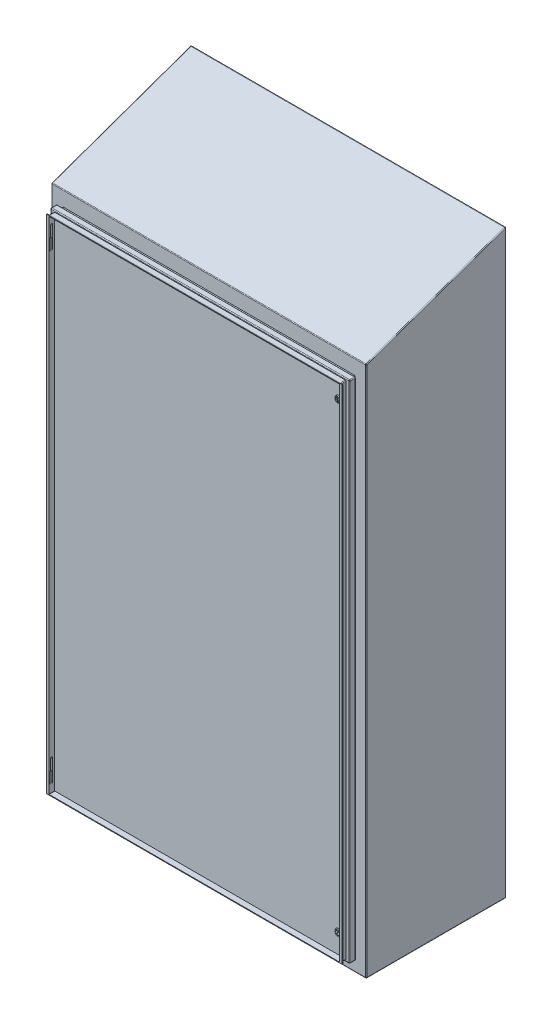
from build123d import *
from build123d.topology import SkipClean

# Parameters (mm, degrees)
SKETCH3_W            = 914.4
SKETCH3_H            = 1544.828
EXTRUDE1_DEPTH       = 406.4
SKETCH4_W            = 848.34476
SKETCH4_H            = 1457.94476
EXTRUDE2_DEPTH       = 20.32
SKETCH9_W            = 848.34476
SKETCH9_H            = 1457.94476
EXTRUDE6_DEPTH       = 21.844
EXTRUDE14_DEPTH      = 914.4
FILLET1_R            = 2.371725
SHELL1_T             = -1.89738
SKETCH5_R            = 6.35
CUT_EXTRUDE1_DEPTH   = 1117.712859019
SKETCH23_W           = 859.155
SKETCH23_H           = 1458.0616
EXTRUDE15_DEPTH      = 2.032
SKETCH6_W            = 838.2
SKETCH6_H            = 1447.8
SKETCH6_R            = 2.38125
EXTRUDE3_DEPTH       = 3.175
SKETCH10_R           = 3.57505
SKETCH10_R_2         = 2.38125
EXTRUDE7_DEPTH       = 25.15362
SKETCH7_W            = 868.68
SKETCH7_H            = 1467.5866
EXTRUDE4_DEPTH       = 17.018
FILLET2_R            = 2.371725
SHELL2_T             = -1.89738
FILLET3_R            = 0.762
SKETCH11_R           = 2.38125
EXTRUDE8_DEPTH       = 31.75
EXTRUDE16_DEPTH      = 0.508
EXTRUDE16_DEPTH_BACK = 25.4
SKETCH25_R           = 2.38125
SKETCH26_R           = 4.7625
EXTRUDE17_DEPTH      = 31.242
CHAMFER3_SIZE        = 0.508
EXTRUDE18_DEPTH      = 31.242
SKETCH16_R           = 10.16
EXTRUDE11_DEPTH      = 0.508
SKETCH17_R           = 10.16
EXTRUDE12_DEPTH      = 2.54
EXTRUDE12_TAPER      = 30
SKETCH18_R           = 6.35
CUT_EXTRUDE4_DEPTH   = 2.032
CHAMFER2_SIZE        = 0.508
SKETCH19_R           = 6.35
EXTRUDE13_DEPTH      = 2.032
FILLET9_R            = 0.762
CUT_EXTRUDE5_DEPTH   = 2.032
LPATTERN3_COUNT      = 2
LPATTERN3_PITCH      = 670.814
LPATTERN3_2_COUNT    = 2
LPATTERN3_2_PITCH    = 670.814
LPATTERN2_COUNT      = 2
LPATTERN2_PITCH      = 670.814


with BuildPart() as part:
    # Sketch3 → Extrude1 (new body)
    with BuildSketch(Plane.XY):
        Rectangle(SKETCH3_W, SKETCH3_H)
    extrude(amount=EXTRUDE1_DEPTH)

    # Sketch4 → Extrude2 (add)
    with BuildSketch(Plane.XY.offset(406.4)):
        Rectangle(SKETCH4_W, SKETCH4_H)
    extrude(amount=EXTRUDE2_DEPTH)

    # Sketch9 → Extrude6 (add)
    with BuildSketch(Plane.XY.offset(426.72)):
        Rectangle(SKETCH9_W, SKETCH9_H)
    extrude(amount=EXTRUDE6_DEPTH)

    # Sketch22 → Extrude14 (add)
    with BuildSketch(Plane(origin=(457.2, 0, 0), x_dir=(0, 0, -1), z_dir=(1, 0, 0))):
        Polygon((-406.4, 772.414), (0, 772.414), (0, 916.686), align=None)
    extrude(amount=-EXTRUDE14_DEPTH)

    # Fillet1
    fillet1_edges = [part.edges().sort_by_distance(p)[0] for p in [
        (457.2, 0, 406.4),
        (0, 772.414, 406.4),
        (424.17238, 728.97238, 427.482),
        (-424.17238, 728.97238, 427.482),
        (-424.17238, -728.97238, 427.482),
        (424.17238, -728.97238, 427.482),
        (-457.2, 844.55, 203.2),
        (0, 916.686, 0),
        (457.2, 844.55, 203.2),
        (-457.2, 0, 406.4),
        (457.2, 72.136, 0),
        (0, -772.414, 0),
        (-457.2, 72.136, 0),
        (0, -772.414, 406.4),
        (457.2, -772.414, 203.2),
        (-457.2, -772.414, 203.2),
    ]]
    fillet(fillet1_edges, radius=FILLET1_R)

    # Shell1
    shell1_openings = [part.faces().sort_by_distance(p)[0] for p in [
        (0, 0, 448.564),
    ]]
    offset(amount=SHELL1_T, openings=shell1_openings, kind=Kind.INTERSECTION)

    # Sketch5 → Cut-Extrude1 (cut, through all)
    with BuildSketch(Plane.XY.offset(1.89738)):
        with Locations((438.15, 742.95)):
            Circle(SKETCH5_R)
        with Locations((438.15, -742.95)):
            Circle(SKETCH5_R)
        with Locations((-438.15, -742.95)):
            Circle(SKETCH5_R)
        with Locations((-438.15, 742.95)):
            Circle(SKETCH5_R)
    extrude(amount=-CUT_EXTRUDE1_DEPTH, mode=Mode.SUBTRACT)

    # Sketch23 → Extrude15 (add)
    with BuildSketch(Plane.XY.offset(448.564)):
        Rectangle(SKETCH23_W, SKETCH23_H)
        with BuildLine():
            Line((421.800655, 728.97238), (-421.800655, 728.97238))
            ThreePointArc((-421.800655, 728.97238), (-423.477717831, 728.277717831), (-424.17238, 726.600655))
            Line((-424.17238, 726.600655), (-424.17238, -726.600655))
            ThreePointArc((-424.17238, -726.600655), (-423.477717831, -728.277717831), (-421.800655, -728.97238))
            Line((-421.800655, -728.97238), (421.800655, -728.97238))
            ThreePointArc((421.800655, -728.97238), (423.477717831, -728.277717831), (424.17238, -726.600655))
            Line((424.17238, -726.600655), (424.17238, 726.600655))
            ThreePointArc((424.17238, 726.600655), (423.477717831, 728.277717831), (421.800655, 728.97238))
        make_face(mode=Mode.SUBTRACT)
    extrude(amount=-EXTRUDE15_DEPTH)

    # Sketch10 → Extrude7 (add)
    # profile 1 of 4: a face of its own
    with BuildSketch(Plane.XY.offset(1.89738)):
        with Locations((-372.999, 658.749)):
            Circle(SKETCH10_R)
        with Locations((-372.999, 658.749)):
            Circle(SKETCH10_R_2, mode=Mode.SUBTRACT)
    # profile 2 of 4: a face of its own
    with BuildSketch(Plane.XY.offset(1.89738)):
        with Locations((-372.999, -658.749)):
            Circle(SKETCH10_R)
        with Locations((-372.999, -658.749)):
            Circle(SKETCH10_R_2, mode=Mode.SUBTRACT)
    # profile 3 of 4: a face of its own
    with BuildSketch(Plane.XY.offset(1.89738)):
        with Locations((372.999, -658.749)):
            Circle(SKETCH10_R)
        with Locations((372.999, -658.749)):
            Circle(SKETCH10_R_2, mode=Mode.SUBTRACT)
    # profile 4 of 4: a face of its own
    with BuildSketch(Plane.XY.offset(1.89738)):
        with Locations((372.999, 658.749)):
            Circle(SKETCH10_R)
        with Locations((372.999, 658.749)):
            Circle(SKETCH10_R_2, mode=Mode.SUBTRACT)
    extrude(amount=EXTRUDE7_DEPTH)


with BuildPart() as body_2:
    # Sketch6 → Extrude3 (new body)
    with BuildSketch(Plane.XY.offset(28.575)):
        Rectangle(SKETCH6_W, SKETCH6_H)
        with Locations((372.999, -658.749)):
            Circle(SKETCH6_R, mode=Mode.SUBTRACT)
        with Locations((372.999, 658.749)):
            Circle(SKETCH6_R, mode=Mode.SUBTRACT)
        with Locations((-372.999, 658.749)):
            Circle(SKETCH6_R, mode=Mode.SUBTRACT)
        with Locations((-372.999, -658.749)):
            Circle(SKETCH6_R, mode=Mode.SUBTRACT)
    extrude(amount=-EXTRUDE3_DEPTH)


with BuildPart() as body_3:
    # Sketch7 → Extrude4 (new body)
    with BuildSketch(Plane.XY.offset(431.8)):
        Rectangle(SKETCH7_W, SKETCH7_H)
    extrude(amount=-EXTRUDE4_DEPTH)

    # Fillet2
    fillet2_edges = [body_3.edges().sort_by_distance(p)[0] for p in [
        (0, 733.7933, 431.8),
        (434.34, 0, 431.8),
        (0, -733.7933, 431.8),
        (-434.34, 0, 431.8),
        (-434.34, 733.7933, 423.291),
        (434.34, 733.7933, 423.291),
        (434.34, -733.7933, 423.291),
        (-434.34, -733.7933, 423.291),
    ]]
    fillet(fillet2_edges, radius=FILLET2_R)

    # Shell2
    shell2_openings = [body_3.faces().sort_by_distance(p)[0] for p in [
        (0, 0, 414.782),
    ]]
    offset(amount=SHELL2_T, openings=shell2_openings, kind=Kind.INTERSECTION)

    # Fillet3
    fillet3_edges = [body_3.edges().sort_by_distance(p)[0] for p in [
        (0, 733.7933, 414.782),
        (434.34, 0, 414.782),
        (0, -733.7933, 414.782),
        (-434.34, 0, 414.782),
        (-433.645337831, -733.098637831, 414.782),
        (433.645337831, -733.098637831, 414.782),
        (433.645337831, 733.098637831, 414.782),
        (-433.645337831, 733.098637831, 414.782),
    ]]
    fillet(fillet3_edges, radius=FILLET3_R)


with BuildPart() as body_4:
    # Sketch11 → Extrude8 (new body)
    with BuildSketch(Plane(origin=(0, 0, 0), x_dir=(1, 0, 0), z_dir=(0, 1, 0))):
        with BuildLine():
            Line((-421.64762, -441.0075), (-421.64762, -446.532))
            Line((-421.64762, -446.532), (-424.18762, -446.532))
            Line((-424.18762, -446.532), (-424.18762, -445.219613484))
            ThreePointArc((-424.18762, -445.219613484), (-430.488481344, -438.548155575), (-421.64762, -441.0075))
        make_face()
        with Locations(Location((-426.41012, -441.0075, 0), (0, 0, 270))):
            Circle(SKETCH11_R, mode=Mode.SUBTRACT)
    extrude(amount=-EXTRUDE8_DEPTH)

    # Revolve1: read off the stored shape, not the designer's step
    # Revolve1 outline → Revolve1 (revolve)
    with BuildSketch(Plane(origin=(-426.41012, 0, 441.0075), x_dir=(1, 0, 0), z_dir=(0, 0, 1))):
        with BuildLine():
            Line((0, -31.75), (2.381250004, -31.75))
            Line((2.381250004, -31.75), (2.381250004, -27.625554017))
            ThreePointArc((2.381250004, -27.625554017), (1.232625705, -27.149778253), (0, -26.9875))
            Line((0, -26.9875), (0, -31.75))
        make_face()
    revolve(axis=Axis((-426.41012, 0, 441.0075), (0, 1, 0)))


with BuildPart() as body_5:
    # Sketch25 → Extrude16 (new, two sides: drawn at the far end of the back side and taken through both)
    with BuildSketch(Plane(origin=(0, 0, 0), x_dir=(1, 0, 0), z_dir=(0, 1, 0)).offset(-EXTRUDE16_DEPTH_BACK)):
        with Locations(Location((-426.41012, -441.0075, 0), (0, 0, 270))):
            Circle(SKETCH25_R)
    extrude(amount=EXTRUDE16_DEPTH + EXTRUDE16_DEPTH_BACK)

    # Sketch26 → Extrude17 (add)
    with BuildSketch(Plane(origin=(0, 0.508, 0), x_dir=(1, 0, 0), z_dir=(0, 1, 0))):
        with Locations(Location((-426.41012, -441.0075, 0), (0, 0, 90))):
            Circle(SKETCH26_R)
    extrude(amount=EXTRUDE17_DEPTH)

    # Sketch27 → Revolve2 (revolve)
    with BuildSketch(Plane(origin=(0, 31.75, 0), x_dir=(1, 0, 0), z_dir=(0, 1, 0))):
        with BuildLine():
            Line((-431.17262, -441.0075), (-421.64762, -441.0075))
            ThreePointArc((-421.64762, -441.0075), (-426.41012, -436.245), (-431.17262, -441.0075))
        make_face()
    revolve(axis=Axis((-389.465115436, 31.75, 441.0075), (-1, 0, 0)))

    # Chamfer3
    chamfer3_edges = [body_5.edges().sort_by_distance(p)[0] for p in [
        (-426.41012, -25.4, 438.62625),
    ]]
    chamfer(chamfer3_edges, length=CHAMFER3_SIZE)

    # Sketch28 → Extrude18 (add)
    with SkipClean():  # the faces are left unmerged after this step: merging them gives an invalid solid
        with BuildSketch(Plane.XZ.offset(-0.508)):
            with BuildLine():
                Line((-432.44262, 445.77), (-432.44262, 443.23))
                Line((-432.44262, 443.23), (-430.622233484, 443.23))
                ThreePointArc((-430.622233484, 443.23), (-428.869464425, 445.085861344), (-426.41012, 445.77))
                Line((-426.41012, 445.77), (-432.44262, 445.77))
            make_face()
        extrude(amount=-EXTRUDE18_DEPTH)
    add(body_5.part.scale(1), mode=Mode.REPLACE)  # the faces are merged on a copy

    # Combine1: union body 4
    add(body_4.part)


with BuildPart() as body_5_2:
    # Sketch16 → Extrude11 (new body)
    with BuildSketch(Plane.XY.offset(431.8)):
        with Locations((402.59, 0)):
            Circle(SKETCH16_R)
    extrude(amount=EXTRUDE11_DEPTH)

    # Sketch17 → Extrude12 (add)
    with BuildSketch(Plane.XY.offset(432.308)):
        with Locations((402.59, 0)):
            Circle(SKETCH17_R)
    extrude(amount=EXTRUDE12_DEPTH, taper=EXTRUDE12_TAPER)

    # Sketch18 → Cut-Extrude4 (cut)
    with BuildSketch(Plane.XY.offset(434.848)):
        with Locations((402.59, 0)):
            Circle(SKETCH18_R)
    extrude(amount=-CUT_EXTRUDE4_DEPTH, mode=Mode.SUBTRACT)

    # Chamfer2
    chamfer2_edges = [body_5_2.edges().sort_by_distance(p)[0] for p in [
        (396.24, 0, 434.848),
    ]]
    chamfer(chamfer2_edges, length=CHAMFER2_SIZE)

    # Sketch19 → Extrude13 (add)
    with BuildSketch(Plane.XY.offset(432.816)):
        with Locations((402.59, 0)):
            Circle(SKETCH19_R)
    extrude(amount=EXTRUDE13_DEPTH)

    # Fillet9
    # the kernel refuses this fillet: 0.762 mm, written as the material it takes off along each edge
    with BuildSketch(Plane(origin=(402.59, 0, 434.848), x_dir=(1, 0, 0), z_dir=(0, -1, 0))) as fillet9_piece_1:
        with BuildLine():
            CenterArc((5.63157951, -0.762), FILLET9_R, 19.471220634, 70.528779366)
            Line((5.63157951, 0), (6.35, 0))
            Line((6.35, 0), (6.35, -0.508))
        make_face()
    revolve(axis=Axis((402.59, 0, 434.848), (0, 0, 1)), mode=Mode.SUBTRACT)

    # Sketch20 → Cut-Extrude5 (cut)
    with BuildSketch(Plane.XY.offset(434.848)):
        with BuildLine():
            Line((398.379295764, 4.753153673), (404.600999711, -6.023153673))
            ThreePointArc((404.600999711, -6.023153673), (405.765, -5.499261314), (406.800704236, -4.753153673))
            Line((406.800704236, -4.753153673), (400.579000289, 6.023153673))
            ThreePointArc((400.579000289, 6.023153673), (399.415, 5.499261314), (398.379295764, 4.753153673))
        make_face()
    extrude(amount=-CUT_EXTRUDE5_DEPTH, mode=Mode.SUBTRACT)


with BuildPart() as lpattern3_1:
    # LPattern3: pattern copy
    add(body_5.part.moved(Location(Vector(0, 1, 0) * (1 * LPATTERN3_PITCH))))


with BuildPart() as lpattern3_2_1:
    # LPattern3 2: pattern copy
    add(body_5.part.moved(Location(Vector(0, -1, 0) * (1 * LPATTERN3_2_PITCH))))


with BuildPart() as lpattern3_2_2:
    # LPattern3 2: pattern copy
    add(lpattern3_1.part.moved(Location(Vector(0, -1, 0) * (1 * LPATTERN3_2_PITCH))))


with BuildPart() as lpattern2_1:
    # LPattern2: pattern copy
    add(body_5_2.part.moved(Location(Vector(0, 1, 0) * (1 * LPATTERN2_PITCH))))


with BuildPart() as body_8:
    # Mirror2: mirrored copy
    add(lpattern2_1.part.mirror(Plane.ZX))


solid = Compound([part.part, body_2.part, body_3.part, lpattern3_1.part, lpattern3_2_1.part, lpattern2_1.part, body_8.part])
